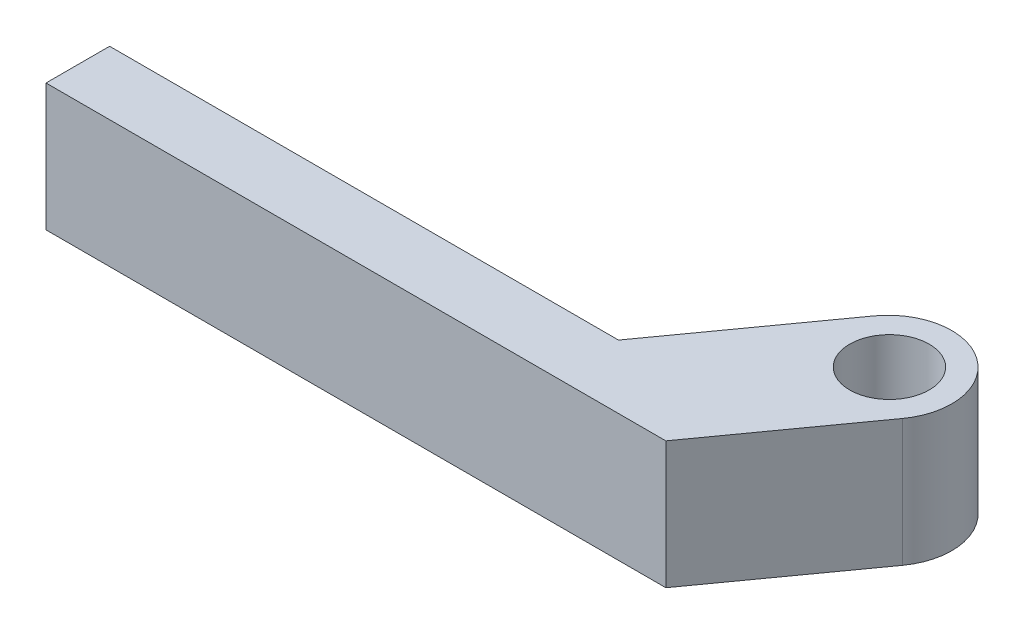
from build123d import *

# Parameters (mm, degrees)
BOSS_EXTRUDE1_DEPTH         = 12.7
F_3_8_16_TAPPED_HOLE1_D     = 7.9375
F_3_8_16_TAPPED_HOLE1_DEPTH = 6.35
F_3_8_16_TAPPED_HOLE1_TIP   = 2.384665582


with BuildPart() as part:
    # Sketch2 → Boss-Extrude1 (new body)
    with BuildSketch(Plane(origin=(0, 0, 0), x_dir=(1, 0, 0), z_dir=(0, 1, 0))):
        with BuildLine():
            Line((-10.638933845, -35.242978242), (0.0062465, -20.425508427))
            ThreePointArc((0.0062465, -20.425508427), (8.868318086, -18.973376472), (10.320450041, -27.835448057))
            Line((10.320450041, -27.835448057), (0.436752504, -41.592978242))
            Line((0.436752504, -41.592978242), (-10.638933845, -41.592978242))
            Line((-10.638933845, -41.592978242), (-61.438933845, -41.592978242))
            Line((-61.438933845, -41.592978242), (-61.438933845, -35.242978242))
            Line((-61.438933845, -35.242978242), (-10.638933845, -35.242978242))
        make_face()
    extrude(amount=BOSS_EXTRUDE1_DEPTH)

    # 3/8-16 Tapped Hole1
    with Locations(Plane(origin=(0, 12.7, 0), x_dir=(1, 0, 0), z_dir=(0, 1, 0))):
        with Locations((5.218739795, -24.053376472)):
            Hole(F_3_8_16_TAPPED_HOLE1_D / 2, depth=F_3_8_16_TAPPED_HOLE1_DEPTH)
            with Locations((0, 0, -(F_3_8_16_TAPPED_HOLE1_DEPTH + F_3_8_16_TAPPED_HOLE1_TIP / 2))):  # 118° drill point
                Cone(0, F_3_8_16_TAPPED_HOLE1_D / 2, F_3_8_16_TAPPED_HOLE1_TIP, mode=Mode.SUBTRACT)


solid = part.part
